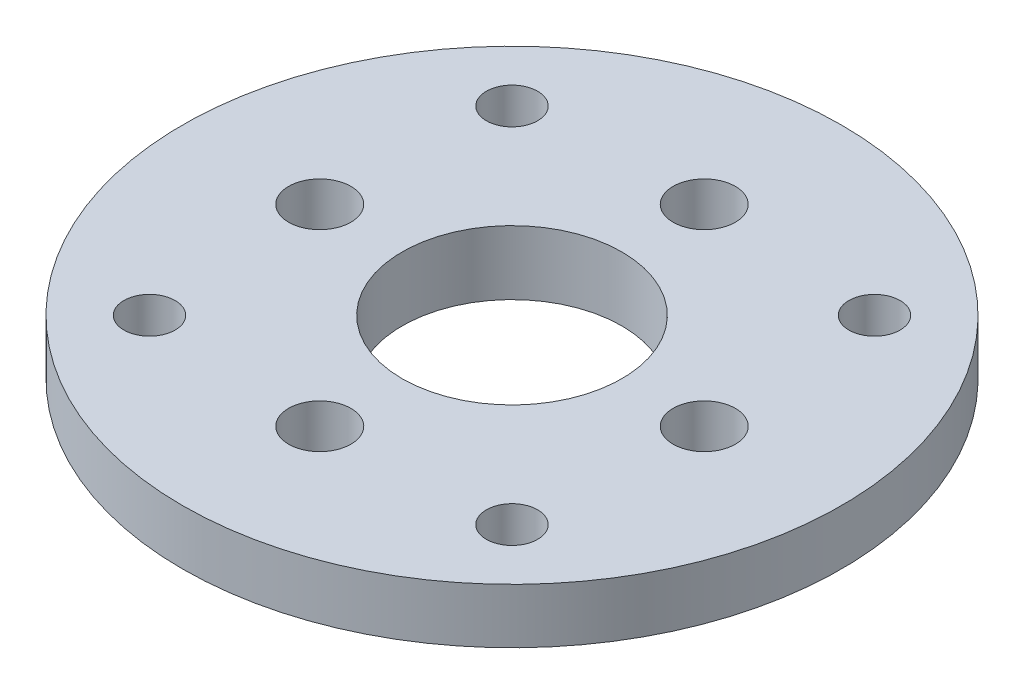
from build123d import *

# Parameters (mm, degrees)
SKETCH1_R           = 16.5
BOSS_EXTRUDE1_DEPTH = 0.5
SKETCH2_R           = 18
BOSS_EXTRUDE2_DEPTH = 3
SKETCH3_R           = 6
CUT_EXTRUDE1_DEPTH  = 26.695330315
SKETCH4_R           = 1.7
CUT_EXTRUDE2_DEPTH  = 26.695330315
CIRPATTERN1_COUNT   = 4
SKETCH5_R           = 1.4
CUT_EXTRUDE3_DEPTH  = 26.695330315
CIRPATTERN2_COUNT   = 4


with BuildPart() as part:
    # Sketch1 → Boss-Extrude1 (new body)
    with BuildSketch(Plane(origin=(0, 0, 0), x_dir=(1, 0, 0), z_dir=(0, 1, 0))):
        Circle(SKETCH1_R)
    extrude(amount=BOSS_EXTRUDE1_DEPTH)

    # Sketch2 → Boss-Extrude2 (add)
    with BuildSketch(Plane(origin=(0, 0.5, 0), x_dir=(1, 0, 0), z_dir=(0, 1, 0))):
        Circle(SKETCH2_R)
    extrude(amount=BOSS_EXTRUDE2_DEPTH)

    # Sketch3 → Cut-Extrude1 (cut, through all)
    with BuildSketch(Plane(origin=(0, 0, 0), x_dir=(1, 0, 0), z_dir=(0, 1, 0))):
        Circle(SKETCH3_R)
    extrude(amount=CUT_EXTRUDE1_DEPTH, mode=Mode.SUBTRACT)

    # Sketch4 → Cut-Extrude2 (cut, through all)
    with BuildSketch(Plane(origin=(0, 0, 0), x_dir=(1, 0, 0), z_dir=(0, 1, 0))):
        with Locations((10.5, 0)):
            Circle(SKETCH4_R)
    cut_extrude2 = extrude(amount=CUT_EXTRUDE2_DEPTH, mode=Mode.SUBTRACT)

    # CirPattern1: Cut-Extrude2 ×4 about axis
    cirpattern1_axis = Axis((0, 3.5, 0), (0, -1, 0))
    for i in range(1, CIRPATTERN1_COUNT):
        add(cut_extrude2.rotate(cirpattern1_axis, i * 360 / CIRPATTERN1_COUNT), mode=Mode.SUBTRACT)

    # Sketch5 → Cut-Extrude3 (cut, through all)
    with BuildSketch(Plane(origin=(0, 0, 0), x_dir=(1, 0, 0), z_dir=(0, 1, 0))):
        with Locations((9.899494937, 9.899494937)):
            Circle(SKETCH5_R)
    cut_extrude3 = extrude(amount=CUT_EXTRUDE3_DEPTH, mode=Mode.SUBTRACT)

    # CirPattern2: Cut-Extrude3 ×4 about axis
    cirpattern2_axis = Axis((0, 3.5, 0), (0, -1, 0))
    for i in range(1, CIRPATTERN2_COUNT):
        add(cut_extrude3.rotate(cirpattern2_axis, i * 360 / CIRPATTERN2_COUNT), mode=Mode.SUBTRACT)


solid = part.part
